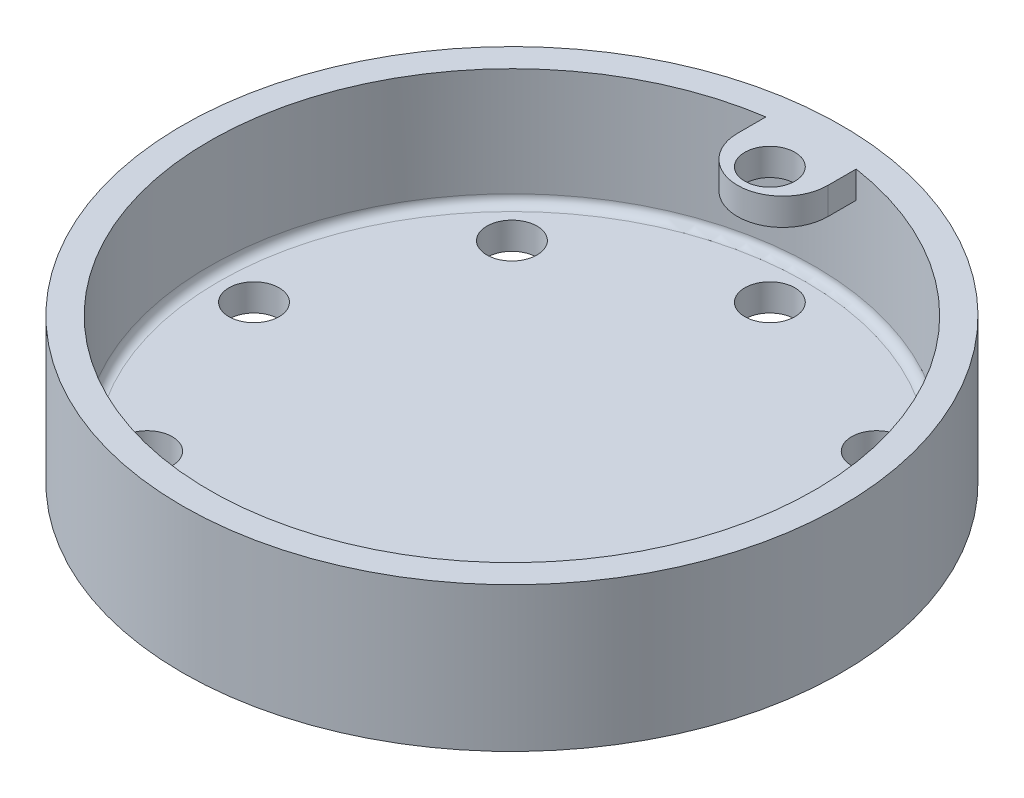
from build123d import *

# Parameters (mm, degrees)
SKETCH1_R           = 73.025
BASE_EXTRUDE_DEPTH  = 32
SHELL1_T            = -6
BOSS_EXTRUDE1_START = -6
BOSS_EXTRUDE1_DEPTH = 6
CUT_EXTRUDE1_REACH  = 110.117
SKETCH3_R           = 5.55625
SKETCH5_R           = 5.55625
CUT_EXTRUDE3_DEPTH  = 107.495545681
CIRPATTERN2_COUNT   = 8
FILLET2_R           = 2


with BuildPart() as part:
    # Sketch1 → Base-Extrude (new body)
    with BuildSketch(Plane(origin=(0, 0, 0), x_dir=(1, 0, 0), z_dir=(0, 1, 0))):
        Circle(SKETCH1_R)
    extrude(amount=BASE_EXTRUDE_DEPTH)

    # Shell1
    shell1_openings = [part.faces().sort_by_distance(p)[0] for p in [
        (0, 32, 0),
    ]]
    offset(amount=SHELL1_T, openings=shell1_openings, kind=Kind.INTERSECTION)

    # Sketch2 → Boss-Extrude1 (add)
    with BuildSketch(Plane(origin=(0, 32, 0), x_dir=(-1, 0, 0), z_dir=(0, 1, 0)).offset(BOSS_EXTRUDE1_START)):
        with BuildLine():
            Line((-10, -66.274811392), (-10, -60))
            ThreePointArc((-10, -60), (0, -50), (10, -60))
            Line((10, -60), (10, -66.274811392))
            ThreePointArc((10, -66.274811392), (0, -67.025), (-10, -66.274811392))
        make_face()
    extrude(amount=BOSS_EXTRUDE1_DEPTH)

    # Sketch3 → Cut-Extrude1 (cut, up to next)
    with BuildSketch(Plane(origin=(0, 32, 0), x_dir=(-1, 0, 0), z_dir=(0, 1, 0)), mode=Mode.PRIVATE) as cut_extrude1_sk1:
        with Locations((0, -57.15)):
            Circle(SKETCH3_R)
    cut_extrude1_tool1 = extrude(cut_extrude1_sk1.sketch, amount=-CUT_EXTRUDE1_REACH, mode=Mode.PRIVATE) & part.part
    add(cut_extrude1_tool1.solids().sort_by_distance((0, 32, -57.15))[0], mode=Mode.SUBTRACT)

    # Sketch5 → Cut-Extrude3 (cut, through all)
    with BuildSketch(Plane(origin=(0, 6, 0), x_dir=(-1, 0, 0), z_dir=(0, 1, 0))):
        with Locations((0, -57.15)):
            Circle(SKETCH5_R)
    cut_extrude3 = extrude(amount=-CUT_EXTRUDE3_DEPTH, mode=Mode.SUBTRACT)

    # CirPattern2: Cut-Extrude3 ×8 about axis
    cirpattern2_axis = Axis((0, 32, 0), (0, -1, 0))
    for i in range(1, CIRPATTERN2_COUNT):
        add(cut_extrude3.rotate(cirpattern2_axis, i * 360 / CIRPATTERN2_COUNT), mode=Mode.SUBTRACT)

    # Fillet2
    fillet2_edges = [part.edges().sort_by_distance(p)[0] for p in [
        (-67.025, 6, 0),
    ]]
    fillet(fillet2_edges, radius=FILLET2_R)


solid = part.part
